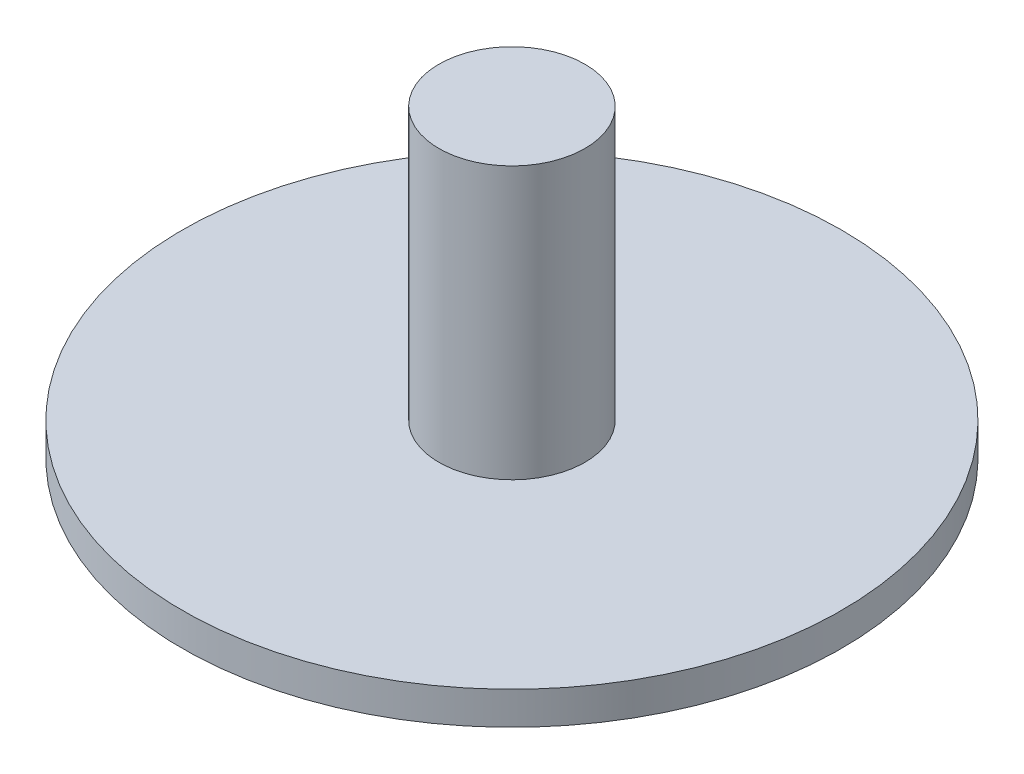
from build123d import *

# Parameters (mm, degrees)
FILLET1_R  = 25
FILLET11_R = 25


# Some blends are built 0.0001 mm under size
with BuildPart() as part:
    # Sketch1 → Revolve1 (revolve)
    with BuildSketch(Plane(origin=(0, 0, 0), x_dir=(0, 0, -1), z_dir=(1, 0, 0))):
        Polygon((0, 0), (5.540701052, 11.882071751), (5.540701052, 16.882071751), (25, 16.882071751), (25, 19.382071751), (5.540701052, 19.382071751), (5.540701052, 40), (0, 40), align=None)
    revolve(axis=Axis((0, 0, 0), (0, 1, 0)))

    # Fillet1
    # the kernel refuses this fillet: 25 mm, written as the material it adds along each edge
    with BuildSketch(Plane(origin=(0, 16.882071751, 0), x_dir=(0, 0, -1), z_dir=(1, 0, 0))) as fillet1_piece_1:
        with BuildLine():
            CenterArc((20.540701052, -25), FILLET1_R, 90, 36.869897646)
            Line((20.540701052, 0), (20.540701052, 0.5))
            Line((20.540701052, 0.5), (5.540701052, 0.5))
            Line((5.540701052, 0.5), (5.040701052, 0))
            ThreePointArc((5.040701052, 0), (5.040701052, -2.5), (5.240701052, -4.6))
            Line((5.240701052, -4.6), (5.540701052, -5))
        make_face()
    revolve(axis=Axis((0, 16.882071751, 0), (0, 1, 0)))

    # Fillet11
    fillet11_edges = [part.edges().sort_by_distance(p)[0] for p in [
        (0, 11.882071751, 5.540701052),
    ]]
    fillet(fillet11_edges, radius=FILLET11_R - 0.0001)  # a hair under: the kernel refuses the full size


solid = part.part
